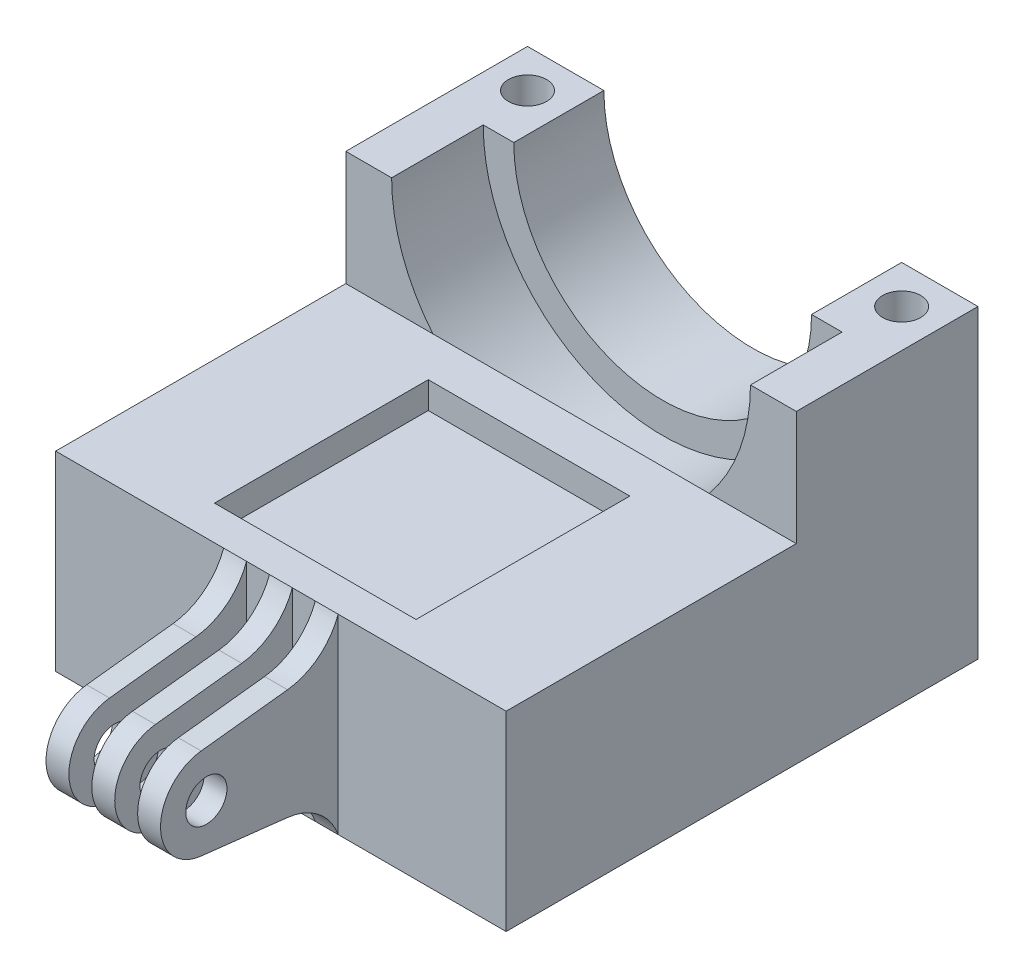
from build123d import *

# Parameters (mm, degrees)
BOSS_EXTRUDE1_DEPTH = 11.8
BOSS_EXTRUDE2_DEPTH = 12
SKETCH3_W           = 59
SKETCH3_H           = 25
BOSS_EXTRUDE3_DEPTH = 38
SKETCH4_W           = 26.4
SKETCH4_H           = 28
CUT_EXTRUDE1_DEPTH  = 3.5
SKETCH5_R           = 2.5
CUT_EXTRUDE2_DEPTH  = 80.30630492
SKETCH6_R           = 2.7
BOSS_EXTRUDE4_DEPTH = 1.5
LPATTERN1_COUNT     = 2
LPATTERN1_PITCH     = 6
LPATTERN1_COL_COUNT = 2
LPATTERN1_COL_PITCH = 6
FILLET1_R           = 8


with BuildPart() as part:
    # Sketch1 → Boss-Extrude1 (new body)
    with BuildSketch(Plane.XY):
        with BuildLine():
            Line((-19.5, 0), (-29.5, 0))
            Line((-29.5, 0), (-29.5, -40))
            Line((-29.5, -40), (29.5, -40))
            Line((29.5, -40), (29.5, 0))
            Line((29.5, 0), (19.5, 0))
            ThreePointArc((19.5, 0), (0, -19.5), (-19.5, 0))
        make_face()
    extrude(amount=BOSS_EXTRUDE1_DEPTH)

    # Sketch2 → Boss-Extrude2 (add)
    with BuildSketch(Plane.XY.offset(11.8)):
        with BuildLine():
            Line((23.499107394, 0), (29.5, 0))
            Line((29.5, 0), (29.5, -40))
            Line((29.5, -40), (-29.5, -40))
            Line((-29.5, -40), (-29.5, 0))
            Line((-29.5, 0), (-23.499107394, 0))
            ThreePointArc((-23.499107394, 0), (0, -23.499107394), (23.499107394, 0))
        make_face()
    extrude(amount=BOSS_EXTRUDE2_DEPTH)

    # Sketch3 → Boss-Extrude3 (add)
    with BuildSketch(Plane.XY.offset(23.8)):
        with Locations((0, -27.5)):
            Rectangle(SKETCH3_W, SKETCH3_H)
    extrude(amount=BOSS_EXTRUDE3_DEPTH)

    # Sketch4 → Cut-Extrude1 (cut)
    with BuildSketch(Plane(origin=(0, -15, 0), x_dir=(1, 0, 0), z_dir=(0, 1, 0))):
        with Locations((0, -43.3)):
            Rectangle(SKETCH4_W, SKETCH4_H)
    extrude(amount=-CUT_EXTRUDE1_DEPTH, mode=Mode.SUBTRACT)

    # Sketch5 → Cut-Extrude2 (cut, through all)
    with BuildSketch(Plane(origin=(0, 0, 0), x_dir=(1, 0, 0), z_dir=(0, 1, 0))):
        with Locations(Location((-24.5, -5, 0), (0, 0, 270))):
            Circle(SKETCH5_R)
        with Locations(Location((24.5, -5, 0), (0, 0, 270))):
            Circle(SKETCH5_R)
    extrude(amount=-CUT_EXTRUDE2_DEPTH, mode=Mode.SUBTRACT)

    # Sketch6 → Boss-Extrude4 (add, symmetric)
    with BuildSketch(Plane(origin=(0, 0, 0), x_dir=(0, 0, -1), z_dir=(1, 0, 0))):
        with BuildLine():
            Line((-61.8, -19.5), (-79.74176436, -21.538350337))
            ThreePointArc((-79.74176436, -21.538350337), (-85.064465832, -27.5), (-79.74176436, -33.461649663))
            Line((-79.74176436, -33.461649663), (-61.8, -35.5))
            Line((-61.8, -35.5), (-61.8, -19.5))
        make_face()
        with Locations((-79.064465832, -27.5)):
            Circle(SKETCH6_R, mode=Mode.SUBTRACT)
    boss_extrude4 = extrude(amount=BOSS_EXTRUDE4_DEPTH, both=True)

    # LPattern1: Boss-Extrude4 ×2
    with Locations(*[(-i * LPATTERN1_PITCH, 0, 0) for i in range(1, LPATTERN1_COUNT)]):
        add(boss_extrude4)

    # LPattern1 col: Boss-Extrude4 ×2
    with Locations(*[(i * LPATTERN1_COL_PITCH, 0, 0) for i in range(1, LPATTERN1_COL_COUNT)]):
        add(boss_extrude4)

    # Fillet1
    # the kernel refuses this fillet: 8 mm, written as the material it adds along each edge
    with BuildSketch(Plane(origin=(-7.5, -35.5, 61.8), x_dir=(0, -1, 0), z_dir=(1, 0, 0)), Plane(origin=(-1.5, -35.5, 61.8), x_dir=(0, -1, 0), z_dir=(1, 0, 0)), Plane(origin=(4.5, -35.5, 61.8), x_dir=(0, -1, 0), z_dir=(1, 0, 0))) as fillet1_piece_1:
        with BuildLine():
            CenterArc((7.195743205, -7.532129086), FILLET1_R, 109.69224948, 63.826210699)
            Line((-0.753123012, -6.629064382), (-0.912100336, -6.611003087))
            Line((-0.912100336, -6.611003087), (-0.158977324, 0.018061294))
            Line((-0.158977324, 0.018061294), (0, 0.16))
            ThreePointArc((0, 0.16), (2.25, 0.16), (4.446085136, 0.150642582))
            Line((4.446085136, 0.150642582), (4.5, 0))
        make_face()
    extrude(amount=3)
    with BuildSketch(Plane(origin=(-7.5, -35.5, 61.8), x_dir=(0, -1, 0), z_dir=(1, 0, 0))) as fillet1_piece_2_section:
        with BuildLine():
            CenterArc((7.195743205, -7.532129086), FILLET1_R, 109.69224948, 63.826210699)
            Line((-0.753123012, -6.629064382), (-0.912100336, -6.611003087))
            Line((-0.912100336, -6.611003087), (-0.158977324, 0.018061294))
            Line((-0.158977324, 0.018061294), (0, 0.16))
            ThreePointArc((0, 0.16), (2.25, 0.16), (4.446085136, 0.150642582))
            Line((4.446085136, 0.150642582), (4.5, 0))
        make_face()
    fillet1_piece_2 = extrude(amount=19.679270227, mode=Mode.PRIVATE)
    fillet1_piece_2 = split(fillet1_piece_2, bisect_by=Plane(origin=(-1.5, -36.458947271, 63.391764359), z_dir=(1, 0, 0)), keep=Keep.TOP, mode=Mode.PRIVATE)
    fillet1_piece_2 = split(fillet1_piece_2, bisect_by=Plane(origin=(1.5, -36.458947271, 63.391764359), z_dir=(-1, 0, 0)), keep=Keep.TOP, mode=Mode.PRIVATE)
    add(fillet1_piece_2)
    with BuildSketch(Plane(origin=(-7.5, -35.5, 61.8), x_dir=(0, -1, 0), z_dir=(1, 0, 0))) as fillet1_piece_3_section:
        with BuildLine():
            CenterArc((7.195743205, -7.532129086), FILLET1_R, 109.69224948, 63.826210699)
            Line((-0.753123012, -6.629064382), (-0.912100336, -6.611003087))
            Line((-0.912100336, -6.611003087), (-0.158977324, 0.018061294))
            Line((-0.158977324, 0.018061294), (0, 0.16))
            ThreePointArc((0, 0.16), (2.25, 0.16), (4.446085136, 0.150642582))
            Line((4.446085136, 0.150642582), (4.5, 0))
        make_face()
    fillet1_piece_3 = extrude(amount=19.679270227, mode=Mode.PRIVATE)
    fillet1_piece_3 = split(fillet1_piece_3, bisect_by=Plane(origin=(4.5, -36.458947271, 63.391764359), z_dir=(1, 0, 0)), keep=Keep.TOP, mode=Mode.PRIVATE)
    fillet1_piece_3 = split(fillet1_piece_3, bisect_by=Plane(origin=(7.5, -36.458947271, 63.391764359), z_dir=(-1, 0, 0)), keep=Keep.TOP, mode=Mode.PRIVATE)
    add(fillet1_piece_3)
    with BuildSketch(Plane(origin=(-7.5, -19.5, 61.8), x_dir=(0, 1, 0), z_dir=(1, 0, 0)), Plane(origin=(-1.5, -19.5, 61.8), x_dir=(0, 1, 0), z_dir=(1, 0, 0)), Plane(origin=(4.5, -19.5, 61.8), x_dir=(0, 1, 0), z_dir=(1, 0, 0))) as fillet1_piece_4:
        with BuildLine():
            CenterArc((7.195743205, 7.532129086), FILLET1_R, 186.481539821, 63.826210699)
            Line((-0.753123012, 6.629064382), (-0.912100336, 6.611003087))
            Line((-0.912100336, 6.611003087), (-0.158977324, -0.018061294))
            Line((-0.158977324, -0.018061294), (0, -0.16))
            ThreePointArc((0, -0.16), (2.25, -0.16), (4.446085136, -0.150642582))
            Line((4.446085136, -0.150642582), (4.5, 0))
        make_face()
    extrude(amount=3)
    with BuildSketch(Plane(origin=(-7.5, -19.5, 61.8), x_dir=(0, 1, 0), z_dir=(1, 0, 0))) as fillet1_piece_5_section:
        with BuildLine():
            CenterArc((7.195743205, 7.532129086), FILLET1_R, 186.481539821, 63.826210699)
            Line((-0.753123012, 6.629064382), (-0.912100336, 6.611003087))
            Line((-0.912100336, 6.611003087), (-0.158977324, -0.018061294))
            Line((-0.158977324, -0.018061294), (0, -0.16))
            ThreePointArc((0, -0.16), (2.25, -0.16), (4.446085136, -0.150642582))
            Line((4.446085136, -0.150642582), (4.5, 0))
        make_face()
    fillet1_piece_5 = extrude(amount=19.679270227, mode=Mode.PRIVATE)
    fillet1_piece_5 = split(fillet1_piece_5, bisect_by=Plane(origin=(-1.5, -18.541052729, 63.391764359), z_dir=(1, 0, 0)), keep=Keep.TOP, mode=Mode.PRIVATE)
    fillet1_piece_5 = split(fillet1_piece_5, bisect_by=Plane(origin=(1.5, -18.541052729, 63.391764359), z_dir=(-1, 0, 0)), keep=Keep.TOP, mode=Mode.PRIVATE)
    add(fillet1_piece_5)
    with BuildSketch(Plane(origin=(-7.5, -19.5, 61.8), x_dir=(0, 1, 0), z_dir=(1, 0, 0))) as fillet1_piece_6_section:
        with BuildLine():
            CenterArc((7.195743205, 7.532129086), FILLET1_R, 186.481539821, 63.826210699)
            Line((-0.753123012, 6.629064382), (-0.912100336, 6.611003087))
            Line((-0.912100336, 6.611003087), (-0.158977324, -0.018061294))
            Line((-0.158977324, -0.018061294), (0, -0.16))
            ThreePointArc((0, -0.16), (2.25, -0.16), (4.446085136, -0.150642582))
            Line((4.446085136, -0.150642582), (4.5, 0))
        make_face()
    fillet1_piece_6 = extrude(amount=19.679270227, mode=Mode.PRIVATE)
    fillet1_piece_6 = split(fillet1_piece_6, bisect_by=Plane(origin=(7.5, -18.541052729, 63.391764359), z_dir=(-1, 0, 0)), keep=Keep.TOP, mode=Mode.PRIVATE)
    fillet1_piece_6 = split(fillet1_piece_6, bisect_by=Plane(origin=(4.5, -18.541052729, 63.391764359), z_dir=(1, 0, 0)), keep=Keep.TOP, mode=Mode.PRIVATE)
    add(fillet1_piece_6)
    with BuildSketch(Plane(origin=(-18.179270227, -35.5, 61.8), x_dir=(0, -1, 0), z_dir=(1, 0, 0))) as fillet1_piece_7_section:
        with BuildLine():
            CenterArc((7.195743205, -7.532129086), FILLET1_R, 109.69224948, 63.826210699)
            Line((-0.753123012, -6.629064382), (-0.912100336, -6.611003087))
            Line((-0.912100336, -6.611003087), (-0.158977324, 0.018061294))
            Line((-0.158977324, 0.018061294), (0, 0.16))
            ThreePointArc((0, 0.16), (2.25, 0.16), (4.446085136, 0.150642582))
            Line((4.446085136, 0.150642582), (4.5, 0))
        make_face()
    fillet1_piece_7 = extrude(amount=19.679270227, mode=Mode.PRIVATE)
    fillet1_piece_7 = split(fillet1_piece_7, bisect_by=Plane(origin=(-7.5, -36.458947271, 63.391764359), z_dir=(1, 0, 0)), keep=Keep.TOP, mode=Mode.PRIVATE)
    fillet1_piece_7 = split(fillet1_piece_7, bisect_by=Plane(origin=(-4.5, -36.458947271, 63.391764359), z_dir=(-1, 0, 0)), keep=Keep.TOP, mode=Mode.PRIVATE)
    add(fillet1_piece_7)
    with BuildSketch(Plane(origin=(-1.5, -35.5, 61.8), x_dir=(0, -1, 0), z_dir=(1, 0, 0))) as fillet1_piece_8_section:
        with BuildLine():
            CenterArc((7.195743205, -7.532129086), FILLET1_R, 109.69224948, 63.826210699)
            Line((-0.753123012, -6.629064382), (-0.912100336, -6.611003087))
            Line((-0.912100336, -6.611003087), (-0.158977324, 0.018061294))
            Line((-0.158977324, 0.018061294), (0, 0.16))
            ThreePointArc((0, 0.16), (2.25, 0.16), (4.446085136, 0.150642582))
            Line((4.446085136, 0.150642582), (4.5, 0))
        make_face()
    fillet1_piece_8 = extrude(amount=19.679270227, mode=Mode.PRIVATE)
    fillet1_piece_8 = split(fillet1_piece_8, bisect_by=Plane(origin=(4.5, -36.458947271, 63.391764359), z_dir=(1, 0, 0)), keep=Keep.TOP, mode=Mode.PRIVATE)
    fillet1_piece_8 = split(fillet1_piece_8, bisect_by=Plane(origin=(7.5, -36.458947271, 63.391764359), z_dir=(-1, 0, 0)), keep=Keep.TOP, mode=Mode.PRIVATE)
    add(fillet1_piece_8)
    with BuildSketch(Plane(origin=(-18.179270227, -19.5, 61.8), x_dir=(0, 1, 0), z_dir=(1, 0, 0))) as fillet1_piece_9_section:
        with BuildLine():
            CenterArc((7.195743205, 7.532129086), FILLET1_R, 186.481539821, 63.826210699)
            Line((-0.753123012, 6.629064382), (-0.912100336, 6.611003087))
            Line((-0.912100336, 6.611003087), (-0.158977324, -0.018061294))
            Line((-0.158977324, -0.018061294), (0, -0.16))
            ThreePointArc((0, -0.16), (2.25, -0.16), (4.446085136, -0.150642582))
            Line((4.446085136, -0.150642582), (4.5, 0))
        make_face()
    fillet1_piece_9 = extrude(amount=19.679270227, mode=Mode.PRIVATE)
    fillet1_piece_9 = split(fillet1_piece_9, bisect_by=Plane(origin=(-7.5, -18.541052729, 63.391764359), z_dir=(1, 0, 0)), keep=Keep.TOP, mode=Mode.PRIVATE)
    fillet1_piece_9 = split(fillet1_piece_9, bisect_by=Plane(origin=(-4.5, -18.541052729, 63.391764359), z_dir=(-1, 0, 0)), keep=Keep.TOP, mode=Mode.PRIVATE)
    add(fillet1_piece_9)
    with BuildSketch(Plane(origin=(-1.5, -19.5, 61.8), x_dir=(0, 1, 0), z_dir=(1, 0, 0))) as fillet1_piece_10_section:
        with BuildLine():
            CenterArc((7.195743205, 7.532129086), FILLET1_R, 186.481539821, 63.826210699)
            Line((-0.753123012, 6.629064382), (-0.912100336, 6.611003087))
            Line((-0.912100336, 6.611003087), (-0.158977324, -0.018061294))
            Line((-0.158977324, -0.018061294), (0, -0.16))
            ThreePointArc((0, -0.16), (2.25, -0.16), (4.446085136, -0.150642582))
            Line((4.446085136, -0.150642582), (4.5, 0))
        make_face()
    fillet1_piece_10 = extrude(amount=19.679270227, mode=Mode.PRIVATE)
    fillet1_piece_10 = split(fillet1_piece_10, bisect_by=Plane(origin=(7.5, -18.541052729, 63.391764359), z_dir=(-1, 0, 0)), keep=Keep.TOP, mode=Mode.PRIVATE)
    fillet1_piece_10 = split(fillet1_piece_10, bisect_by=Plane(origin=(4.5, -18.541052729, 63.391764359), z_dir=(1, 0, 0)), keep=Keep.TOP, mode=Mode.PRIVATE)
    add(fillet1_piece_10)
    with BuildSketch(Plane(origin=(-12.179270227, -35.5, 61.8), x_dir=(0, -1, 0), z_dir=(1, 0, 0))) as fillet1_piece_11_section:
        with BuildLine():
            CenterArc((7.195743205, -7.532129086), FILLET1_R, 109.69224948, 63.826210699)
            Line((-0.753123012, -6.629064382), (-0.912100336, -6.611003087))
            Line((-0.912100336, -6.611003087), (-0.158977324, 0.018061294))
            Line((-0.158977324, 0.018061294), (0, 0.16))
            ThreePointArc((0, 0.16), (2.25, 0.16), (4.446085136, 0.150642582))
            Line((4.446085136, 0.150642582), (4.5, 0))
        make_face()
    fillet1_piece_11 = extrude(amount=19.679270227, mode=Mode.PRIVATE)
    fillet1_piece_11 = split(fillet1_piece_11, bisect_by=Plane(origin=(-7.5, -36.458947271, 63.391764359), z_dir=(1, 0, 0)), keep=Keep.TOP, mode=Mode.PRIVATE)
    fillet1_piece_11 = split(fillet1_piece_11, bisect_by=Plane(origin=(-4.5, -36.458947271, 63.391764359), z_dir=(-1, 0, 0)), keep=Keep.TOP, mode=Mode.PRIVATE)
    add(fillet1_piece_11)
    with BuildSketch(Plane(origin=(-12.179270227, -35.5, 61.8), x_dir=(0, -1, 0), z_dir=(1, 0, 0))) as fillet1_piece_12_section:
        with BuildLine():
            CenterArc((7.195743205, -7.532129086), FILLET1_R, 109.69224948, 63.826210699)
            Line((-0.753123012, -6.629064382), (-0.912100336, -6.611003087))
            Line((-0.912100336, -6.611003087), (-0.158977324, 0.018061294))
            Line((-0.158977324, 0.018061294), (0, 0.16))
            ThreePointArc((0, 0.16), (2.25, 0.16), (4.446085136, 0.150642582))
            Line((4.446085136, 0.150642582), (4.5, 0))
        make_face()
    fillet1_piece_12 = extrude(amount=19.679270227, mode=Mode.PRIVATE)
    fillet1_piece_12 = split(fillet1_piece_12, bisect_by=Plane(origin=(-1.5, -36.458947271, 63.391764359), z_dir=(1, 0, 0)), keep=Keep.TOP, mode=Mode.PRIVATE)
    fillet1_piece_12 = split(fillet1_piece_12, bisect_by=Plane(origin=(1.5, -36.458947271, 63.391764359), z_dir=(-1, 0, 0)), keep=Keep.TOP, mode=Mode.PRIVATE)
    add(fillet1_piece_12)
    with BuildSketch(Plane(origin=(-12.179270227, -19.5, 61.8), x_dir=(0, 1, 0), z_dir=(1, 0, 0))) as fillet1_piece_13_section:
        with BuildLine():
            CenterArc((7.195743205, 7.532129086), FILLET1_R, 186.481539821, 63.826210699)
            Line((-0.753123012, 6.629064382), (-0.912100336, 6.611003087))
            Line((-0.912100336, 6.611003087), (-0.158977324, -0.018061294))
            Line((-0.158977324, -0.018061294), (0, -0.16))
            ThreePointArc((0, -0.16), (2.25, -0.16), (4.446085136, -0.150642582))
            Line((4.446085136, -0.150642582), (4.5, 0))
        make_face()
    fillet1_piece_13 = extrude(amount=19.679270227, mode=Mode.PRIVATE)
    fillet1_piece_13 = split(fillet1_piece_13, bisect_by=Plane(origin=(-7.5, -18.541052729, 63.391764359), z_dir=(1, 0, 0)), keep=Keep.TOP, mode=Mode.PRIVATE)
    fillet1_piece_13 = split(fillet1_piece_13, bisect_by=Plane(origin=(-4.5, -18.541052729, 63.391764359), z_dir=(-1, 0, 0)), keep=Keep.TOP, mode=Mode.PRIVATE)
    add(fillet1_piece_13)
    with BuildSketch(Plane(origin=(-12.179270227, -19.5, 61.8), x_dir=(0, 1, 0), z_dir=(1, 0, 0))) as fillet1_piece_14_section:
        with BuildLine():
            CenterArc((7.195743205, 7.532129086), FILLET1_R, 186.481539821, 63.826210699)
            Line((-0.753123012, 6.629064382), (-0.912100336, 6.611003087))
            Line((-0.912100336, 6.611003087), (-0.158977324, -0.018061294))
            Line((-0.158977324, -0.018061294), (0, -0.16))
            ThreePointArc((0, -0.16), (2.25, -0.16), (4.446085136, -0.150642582))
            Line((4.446085136, -0.150642582), (4.5, 0))
        make_face()
    fillet1_piece_14 = extrude(amount=19.679270227, mode=Mode.PRIVATE)
    fillet1_piece_14 = split(fillet1_piece_14, bisect_by=Plane(origin=(-1.5, -18.541052729, 63.391764359), z_dir=(1, 0, 0)), keep=Keep.TOP, mode=Mode.PRIVATE)
    fillet1_piece_14 = split(fillet1_piece_14, bisect_by=Plane(origin=(1.5, -18.541052729, 63.391764359), z_dir=(-1, 0, 0)), keep=Keep.TOP, mode=Mode.PRIVATE)
    add(fillet1_piece_14)


solid = part.part
